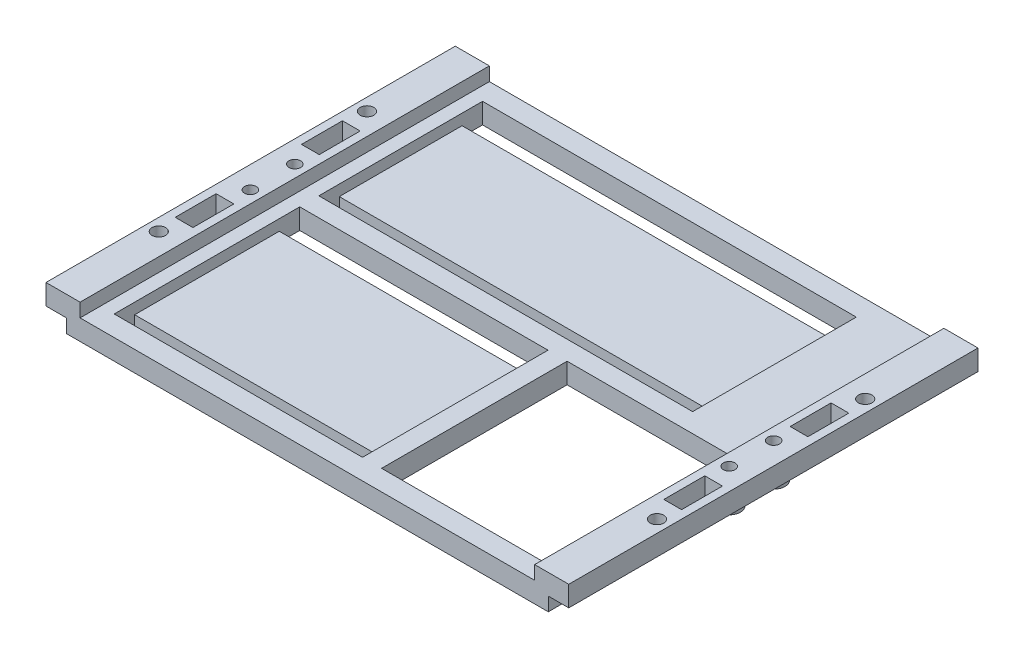
from build123d import *

# Parameters (mm, degrees)
PLATEFRAME_DEPTH          = 150
SKETCH3_R                 = 2.5
HOLESUPPORT_DEPTH         = 244.653052515
SKETCH4_R                 = 4.15
SKETCH4_R_2               = 2.15
CYLINDRICALSUPPORTS_DEPTH = 12.5
SKETCH8_W                 = 137
SKETCH8_H                 = 60
SKETCH8_W_2               = 91
SKETCH8_H_2               = 68
ITEMLAYOUT_DEPTH          = 4
SKETCH9_W                 = 58.6
SKETCH9_H                 = 68
HOLECUTOUT_DEPTH          = 7.5
SKETCH10_W                = 91
SKETCH10_H                = 7.5
SKETCH10_W_2              = 137
VELCROCUT_DEPTH           = 3.5
SKETCH11_W                = 6.5
SKETCH11_H                = 15
CUTSHELLHOLES_DEPTH       = 12.5
SKETCH12_R                = 2.5
STANDOFFHOLES_DEPTH       = 244.653052515


with BuildPart() as part:
    # Sketch2 → PlateFrame (new body)
    with BuildSketch(Plane.XY):
        Polygon((179.1, 12.5), (191.6, 12.5), (191.6, 5), (184.1, 5), (184.1, 0), (7.5, 0), (7.5, 5), (0, 5), (0, 12.5), (12.5, 12.5), (12.5, 7.5), (179.1, 7.5), align=None)
    extrude(amount=PLATEFRAME_DEPTH)

    # Sketch3 → HoleSupport (cut, through all)
    with BuildSketch(Plane(origin=(0, 12.5, 0), x_dir=(1, 0, 0), z_dir=(0, 1, 0))):
        with Locations((8.05, -66.85)):
            Circle(SKETCH3_R)
        with Locations((8.05, -83.15)):
            Circle(SKETCH3_R)
        with Locations((183.55, -66.85)):
            Circle(SKETCH3_R)
        with Locations((183.55, -83.15)):
            Circle(SKETCH3_R)
    extrude(amount=-HOLESUPPORT_DEPTH, mode=Mode.SUBTRACT)

    # Sketch4 → CylindricalSupports (add)
    # profile 1 of 4: a face of its own
    with BuildSketch(Plane(origin=(0, 12.5, 0), x_dir=(1, 0, 0), z_dir=(0, 1, 0))):
        with Locations((183.55, -66.85)):
            Circle(SKETCH4_R)
        with Locations((183.55, -66.85)):
            Circle(SKETCH4_R_2, mode=Mode.SUBTRACT)
    # profile 2 of 4: a face of its own
    with BuildSketch(Plane(origin=(0, 12.5, 0), x_dir=(1, 0, 0), z_dir=(0, 1, 0))):
        with Locations((183.55, -83.15)):
            Circle(SKETCH4_R)
        with Locations((183.55, -83.15)):
            Circle(SKETCH4_R_2, mode=Mode.SUBTRACT)
    # profile 3 of 4: a face of its own
    with BuildSketch(Plane(origin=(0, 12.5, 0), x_dir=(1, 0, 0), z_dir=(0, 1, 0))):
        with Locations((8.05, -66.85)):
            Circle(SKETCH4_R)
        with Locations((8.05, -66.85)):
            Circle(SKETCH4_R_2, mode=Mode.SUBTRACT)
    # profile 4 of 4: a face of its own
    with BuildSketch(Plane(origin=(0, 12.5, 0), x_dir=(1, 0, 0), z_dir=(0, 1, 0))):
        with Locations((8.05, -83.15)):
            Circle(SKETCH4_R)
        with Locations((8.05, -83.15)):
            Circle(SKETCH4_R_2, mode=Mode.SUBTRACT)
    extrude(amount=-CYLINDRICALSUPPORTS_DEPTH)

    # Sketch8 → ItemLayout (cut)
    with BuildSketch(Plane(origin=(0, 7.5, 0), x_dir=(1, 0, 0), z_dir=(0, 1, 0))):
        with Locations((86, -37.5)):
            Rectangle(SKETCH8_W, SKETCH8_H)
        with Locations((63, -108.5)):
            Rectangle(SKETCH8_W_2, SKETCH8_H_2)
    extrude(amount=-ITEMLAYOUT_DEPTH, mode=Mode.SUBTRACT)

    # Sketch9 → HoleCutout (cut)
    with BuildSketch(Plane(origin=(0, 7.5, 0), x_dir=(1, 0, 0), z_dir=(0, 1, 0))):
        with Locations((144.8, -108.5)):
            Rectangle(SKETCH9_W, SKETCH9_H)
    extrude(amount=-HOLECUTOUT_DEPTH, mode=Mode.SUBTRACT)

    # Sketch10 → VelcroCut (cut)
    with BuildSketch(Plane(origin=(0, 3.5, 0), x_dir=(1, 0, 0), z_dir=(0, 1, 0))):
        with Locations((63, -78.25)):
            Rectangle(SKETCH10_W, SKETCH10_H)
        with Locations((63, -138.75)):
            Rectangle(SKETCH10_W, SKETCH10_H)
        with Locations((86, -11.25)):
            Rectangle(SKETCH10_W_2, SKETCH10_H)
        with Locations((86, -63.75)):
            Rectangle(SKETCH10_W_2, SKETCH10_H)
    extrude(amount=-VELCROCUT_DEPTH, mode=Mode.SUBTRACT)

    # Sketch11 → CutShellHoles (cut)
    with BuildSketch(Plane(origin=(0, 12.5, 0), x_dir=(1, 0, 0), z_dir=(0, 1, 0))):
        with Locations((6.25, -51.85)):
            Rectangle(SKETCH11_W, SKETCH11_H)
        with Locations((185.35, -51.85)):
            Rectangle(SKETCH11_W, SKETCH11_H)
        with Locations((185.35, -98.15)):
            Rectangle(SKETCH11_W, SKETCH11_H)
        with Locations((6.25, -98.15)):
            Rectangle(SKETCH11_W, SKETCH11_H)
    extrude(amount=-CUTSHELLHOLES_DEPTH, mode=Mode.SUBTRACT)

    # Sketch12 → StandoffHoles (cut, through all)
    with BuildSketch(Plane(origin=(0, 12.5, 0), x_dir=(1, 0, 0), z_dir=(0, 1, 0))):
        with Locations((4.5, -36.85)):
            Circle(SKETCH12_R)
        with Locations((4.5, -113.15)):
            Circle(SKETCH12_R)
        with Locations((187.1, -36.85)):
            Circle(SKETCH12_R)
        with Locations((187.1, -113.15)):
            Circle(SKETCH12_R)
    extrude(amount=-STANDOFFHOLES_DEPTH, mode=Mode.SUBTRACT)


solid = part.part
